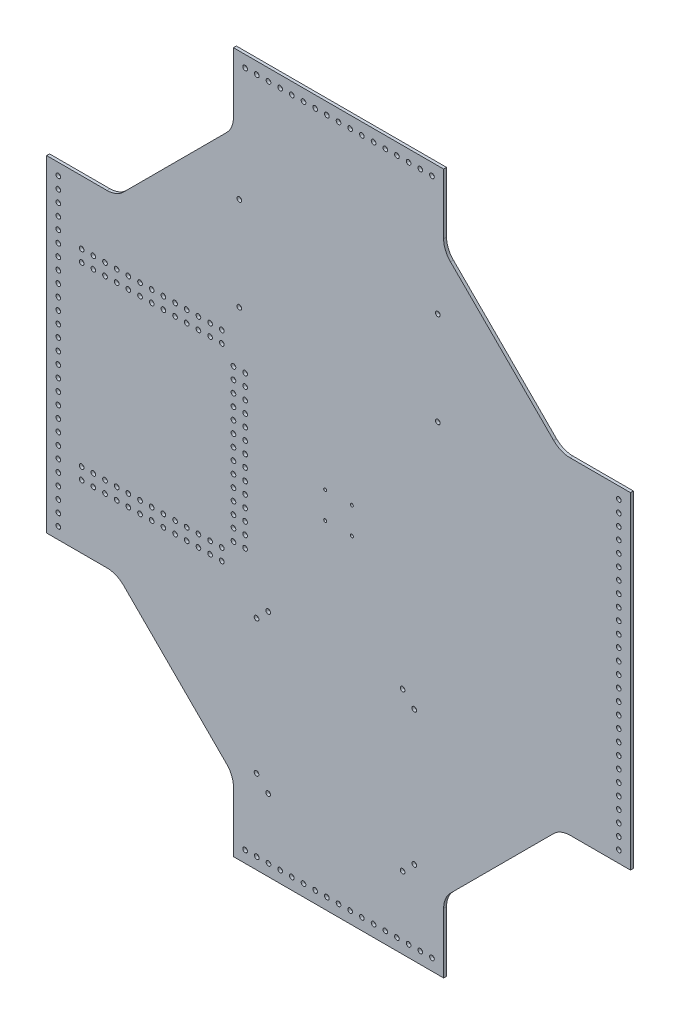
from build123d import *

# Parameters (mm, degrees)
BOSS_EXTRUDE1_DEPTH = 3.175
SKETCH2_R           = 2.54
CUT_EXTRUDE2_DEPTH  = 3.175
SKETCH3_R           = 1.651
SKETCH3_R_2         = 2.54
CUT_EXTRUDE3_DEPTH  = 3.175
SKETCH4_R           = 2.54
CUT_EXTRUDE5_DEPTH  = 3.175
SKETCH5_R           = 2.54
CUT_EXTRUDE7_DEPTH  = 3.175
FILLET1_R           = 25.4
FILLET2_R           = 25.4
FILLET3_R           = 25.4
FILLET4_R           = 25.4
FILLET5_R           = 25.4


with BuildPart() as part:
    # Sketch1 → Boss-Extrude1 (new body)
    with BuildSketch(Plane.XY):
        Polygon((-241.3, 177.8), (-317.5, 177.8), (-317.5, -177.8), (-241.3, -177.8), (-114.3, -304.8), (-114.3, -381), (114.3, -381), (114.3, -304.8), (241.3, -177.8), (317.5, -177.8), (317.5, 177.8), (241.3, 177.8), (114.3, 304.8), (114.3, 381), (-114.3, 381), (-114.3, 304.8), align=None)
    extrude(amount=BOSS_EXTRUDE1_DEPTH)

    # Sketch2 → Cut-Extrude2 (cut)
    with BuildSketch(Plane.XY.offset(3.175)):
        with Locations((-304.8, 165.1)):
            Circle(SKETCH2_R)
        with Locations((-304.8, 152.4)):
            Circle(SKETCH2_R)
        with Locations((-304.8, 139.7)):
            Circle(SKETCH2_R)
        with Locations((-304.8, 127)):
            Circle(SKETCH2_R)
        with Locations((-304.8, 114.3)):
            Circle(SKETCH2_R)
        with Locations((-304.8, 101.6)):
            Circle(SKETCH2_R)
        with Locations((-304.8, 88.9)):
            Circle(SKETCH2_R)
        with Locations((-304.8, 76.2)):
            Circle(SKETCH2_R)
        with Locations((-304.8, 63.5)):
            Circle(SKETCH2_R)
        with Locations((-304.8, 50.8)):
            Circle(SKETCH2_R)
        with Locations((-304.8, 38.1)):
            Circle(SKETCH2_R)
        with Locations((-304.8, 25.4)):
            Circle(SKETCH2_R)
        with Locations((-304.8, 12.7)):
            Circle(SKETCH2_R)
        with Locations((-304.8, 0)):
            Circle(SKETCH2_R)
        with Locations((-304.8, -12.7)):
            Circle(SKETCH2_R)
        with Locations((-304.8, -25.4)):
            Circle(SKETCH2_R)
        with Locations((-304.8, -38.1)):
            Circle(SKETCH2_R)
        with Locations((-304.8, -50.8)):
            Circle(SKETCH2_R)
        with Locations((-304.8, -63.5)):
            Circle(SKETCH2_R)
        with Locations((-304.8, -76.2)):
            Circle(SKETCH2_R)
        with Locations((-304.8, -88.9)):
            Circle(SKETCH2_R)
        with Locations((-304.8, -101.6)):
            Circle(SKETCH2_R)
        with Locations((-304.8, -114.3)):
            Circle(SKETCH2_R)
        with Locations((-304.8, -127)):
            Circle(SKETCH2_R)
        with Locations((-304.8, -139.7)):
            Circle(SKETCH2_R)
        with Locations((-304.8, -152.4)):
            Circle(SKETCH2_R)
        with Locations((-304.8, -165.1)):
            Circle(SKETCH2_R)
        with Locations((304.8, -165.1)):
            Circle(SKETCH2_R)
        with Locations((304.8, -152.4)):
            Circle(SKETCH2_R)
        with Locations((304.8, -139.7)):
            Circle(SKETCH2_R)
        with Locations((304.8, -127)):
            Circle(SKETCH2_R)
        with Locations((304.8, -114.3)):
            Circle(SKETCH2_R)
        with Locations((304.8, -101.6)):
            Circle(SKETCH2_R)
        with Locations((304.8, -88.9)):
            Circle(SKETCH2_R)
        with Locations((304.8, -76.2)):
            Circle(SKETCH2_R)
        with Locations((304.8, -63.5)):
            Circle(SKETCH2_R)
        with Locations((304.8, -50.8)):
            Circle(SKETCH2_R)
        with Locations((304.8, -38.1)):
            Circle(SKETCH2_R)
        with Locations((304.8, -25.4)):
            Circle(SKETCH2_R)
        with Locations((304.8, -12.7)):
            Circle(SKETCH2_R)
        with Locations((304.8, 0)):
            Circle(SKETCH2_R)
        with Locations((304.8, 12.7)):
            Circle(SKETCH2_R)
        with Locations((304.8, 25.4)):
            Circle(SKETCH2_R)
        with Locations((304.8, 38.1)):
            Circle(SKETCH2_R)
        with Locations((304.8, 50.8)):
            Circle(SKETCH2_R)
        with Locations((304.8, 63.5)):
            Circle(SKETCH2_R)
        with Locations((304.8, 76.2)):
            Circle(SKETCH2_R)
        with Locations((304.8, 88.9)):
            Circle(SKETCH2_R)
        with Locations((304.8, 101.6)):
            Circle(SKETCH2_R)
        with Locations((304.8, 114.3)):
            Circle(SKETCH2_R)
        with Locations((304.8, 127)):
            Circle(SKETCH2_R)
        with Locations((304.8, 139.7)):
            Circle(SKETCH2_R)
        with Locations((304.8, 152.4)):
            Circle(SKETCH2_R)
        with Locations((304.8, 165.1)):
            Circle(SKETCH2_R)
        with Locations((-101.6, -368.3)):
            Circle(SKETCH2_R)
        with Locations((-88.9, -368.3)):
            Circle(SKETCH2_R)
        with Locations((-76.2, -368.3)):
            Circle(SKETCH2_R)
        with Locations((-63.5, -368.3)):
            Circle(SKETCH2_R)
        with Locations((-50.8, -368.3)):
            Circle(SKETCH2_R)
        with Locations((-38.1, -368.3)):
            Circle(SKETCH2_R)
        with Locations((-25.4, -368.3)):
            Circle(SKETCH2_R)
        with Locations((-12.7, -368.3)):
            Circle(SKETCH2_R)
        with Locations((0, -368.3)):
            Circle(SKETCH2_R)
        with Locations((12.7, -368.3)):
            Circle(SKETCH2_R)
        with Locations((25.4, -368.3)):
            Circle(SKETCH2_R)
        with Locations((38.1, -368.3)):
            Circle(SKETCH2_R)
        with Locations((50.8, -368.3)):
            Circle(SKETCH2_R)
        with Locations((63.5, -368.3)):
            Circle(SKETCH2_R)
        with Locations((76.2, -368.3)):
            Circle(SKETCH2_R)
        with Locations((88.9, -368.3)):
            Circle(SKETCH2_R)
        with Locations((101.6, -368.3)):
            Circle(SKETCH2_R)
        with Locations((101.6, 368.3)):
            Circle(SKETCH2_R)
        with Locations((88.9, 368.3)):
            Circle(SKETCH2_R)
        with Locations((76.2, 368.3)):
            Circle(SKETCH2_R)
        with Locations((63.5, 368.3)):
            Circle(SKETCH2_R)
        with Locations((50.8, 368.3)):
            Circle(SKETCH2_R)
        with Locations((38.1, 368.3)):
            Circle(SKETCH2_R)
        with Locations((25.4, 368.3)):
            Circle(SKETCH2_R)
        with Locations((12.7, 368.3)):
            Circle(SKETCH2_R)
        with Locations((0, 368.3)):
            Circle(SKETCH2_R)
        with Locations((-12.7, 368.3)):
            Circle(SKETCH2_R)
        with Locations((-25.4, 368.3)):
            Circle(SKETCH2_R)
        with Locations((-38.1, 368.3)):
            Circle(SKETCH2_R)
        with Locations((-50.8, 368.3)):
            Circle(SKETCH2_R)
        with Locations((-63.5, 368.3)):
            Circle(SKETCH2_R)
        with Locations((-76.2, 368.3)):
            Circle(SKETCH2_R)
        with Locations((-88.9, 368.3)):
            Circle(SKETCH2_R)
        with Locations((-101.6, 368.3)):
            Circle(SKETCH2_R)
    extrude(amount=-CUT_EXTRUDE2_DEPTH, mode=Mode.SUBTRACT)

    # Sketch3 → Cut-Extrude3 (cut)
    with BuildSketch(Plane.XY.offset(3.175)):
        with Locations((-14.478, 14.478)):
            Circle(SKETCH3_R)
        with Locations((14.478, 14.478)):
            Circle(SKETCH3_R)
        with Locations((-14.478, -14.478)):
            Circle(SKETCH3_R)
        with Locations((14.478, -14.478)):
            Circle(SKETCH3_R)
        with Locations((-107.95, 241.3)):
            Circle(SKETCH3_R_2)
        with Locations((107.95, 241.3)):
            Circle(SKETCH3_R_2)
        with Locations((-107.95, 139.7)):
            Circle(SKETCH3_R_2)
        with Locations((107.95, 139.7)):
            Circle(SKETCH3_R_2)
    extrude(amount=-CUT_EXTRUDE3_DEPTH, mode=Mode.SUBTRACT)

    # Sketch4 → Cut-Extrude5 (cut)
    with BuildSketch(Plane.XY.offset(3.175)):
        with Locations((-114.3, -84.201)):
            Circle(SKETCH4_R)
        with Locations((-114.3, 80.899)):
            Circle(SKETCH4_R)
        with Locations((-279.4, 96.139)):
            Circle(SKETCH4_R)
        with Locations((-266.7, 96.139)):
            Circle(SKETCH4_R)
        with Locations((-254, 96.139)):
            Circle(SKETCH4_R)
        with Locations((-241.3, 96.139)):
            Circle(SKETCH4_R)
        with Locations((-228.6, 96.139)):
            Circle(SKETCH4_R)
        with Locations((-215.9, 96.139)):
            Circle(SKETCH4_R)
        with Locations((-203.2, 96.139)):
            Circle(SKETCH4_R)
        with Locations((-190.5, 96.139)):
            Circle(SKETCH4_R)
        with Locations((-177.8, 96.139)):
            Circle(SKETCH4_R)
        with Locations((-165.1, 96.139)):
            Circle(SKETCH4_R)
        with Locations((-152.4, 96.139)):
            Circle(SKETCH4_R)
        with Locations((-139.7, 96.139)):
            Circle(SKETCH4_R)
        with Locations((-127, 96.139)):
            Circle(SKETCH4_R)
        with Locations((-127, -96.139)):
            Circle(SKETCH4_R)
        with Locations((-139.7, -96.139)):
            Circle(SKETCH4_R)
        with Locations((-152.4, -96.139)):
            Circle(SKETCH4_R)
        with Locations((-165.1, -96.139)):
            Circle(SKETCH4_R)
        with Locations((-177.8, -96.139)):
            Circle(SKETCH4_R)
        with Locations((-190.5, -96.139)):
            Circle(SKETCH4_R)
        with Locations((-203.2, -96.139)):
            Circle(SKETCH4_R)
        with Locations((-215.9, -96.139)):
            Circle(SKETCH4_R)
        with Locations((-228.6, -96.139)):
            Circle(SKETCH4_R)
        with Locations((-241.3, -96.139)):
            Circle(SKETCH4_R)
        with Locations((-254, -96.139)):
            Circle(SKETCH4_R)
        with Locations((-266.7, -96.139)):
            Circle(SKETCH4_R)
        with Locations((-279.4, -96.139)):
            Circle(SKETCH4_R)
        with Locations((-279.4, -108.839)):
            Circle(SKETCH4_R)
        with Locations((-279.4, 108.839)):
            Circle(SKETCH4_R)
        with Locations((-266.7, 108.839)):
            Circle(SKETCH4_R)
        with Locations((-254, 108.839)):
            Circle(SKETCH4_R)
        with Locations((-241.3, 108.839)):
            Circle(SKETCH4_R)
        with Locations((-228.6, 108.839)):
            Circle(SKETCH4_R)
        with Locations((-215.9, 108.839)):
            Circle(SKETCH4_R)
        with Locations((-203.2, 108.839)):
            Circle(SKETCH4_R)
        with Locations((-190.5, 108.839)):
            Circle(SKETCH4_R)
        with Locations((-177.8, 108.839)):
            Circle(SKETCH4_R)
        with Locations((-165.1, 108.839)):
            Circle(SKETCH4_R)
        with Locations((-152.4, 108.839)):
            Circle(SKETCH4_R)
        with Locations((-139.7, 108.839)):
            Circle(SKETCH4_R)
        with Locations((-127, 108.839)):
            Circle(SKETCH4_R)
        with Locations((-127, -108.839)):
            Circle(SKETCH4_R)
        with Locations((-139.7, -108.839)):
            Circle(SKETCH4_R)
        with Locations((-152.4, -108.839)):
            Circle(SKETCH4_R)
        with Locations((-165.1, -108.839)):
            Circle(SKETCH4_R)
        with Locations((-177.8, -108.839)):
            Circle(SKETCH4_R)
        with Locations((-190.5, -108.839)):
            Circle(SKETCH4_R)
        with Locations((-203.2, -108.839)):
            Circle(SKETCH4_R)
        with Locations((-215.9, -108.839)):
            Circle(SKETCH4_R)
        with Locations((-228.6, -108.839)):
            Circle(SKETCH4_R)
        with Locations((-241.3, -108.839)):
            Circle(SKETCH4_R)
        with Locations((-254, -108.839)):
            Circle(SKETCH4_R)
        with Locations((-266.7, -108.839)):
            Circle(SKETCH4_R)
        with Locations((-114.3, 68.199)):
            Circle(SKETCH4_R)
        with Locations((-101.6, -84.201)):
            Circle(SKETCH4_R)
        with Locations((-101.6, -71.501)):
            Circle(SKETCH4_R)
        with Locations((-101.6, -58.801)):
            Circle(SKETCH4_R)
        with Locations((-101.6, -46.101)):
            Circle(SKETCH4_R)
        with Locations((-101.6, -33.401)):
            Circle(SKETCH4_R)
        with Locations((-101.6, -20.701)):
            Circle(SKETCH4_R)
        with Locations((-101.6, -8.001)):
            Circle(SKETCH4_R)
        with Locations((-101.6, 4.699)):
            Circle(SKETCH4_R)
        with Locations((-101.6, 17.399)):
            Circle(SKETCH4_R)
        with Locations((-101.6, 30.099)):
            Circle(SKETCH4_R)
        with Locations((-101.6, 42.799)):
            Circle(SKETCH4_R)
        with Locations((-101.6, 55.499)):
            Circle(SKETCH4_R)
        with Locations((-101.6, 68.199)):
            Circle(SKETCH4_R)
        with Locations((-101.6, 80.899)):
            Circle(SKETCH4_R)
        with Locations((-114.3, 55.499)):
            Circle(SKETCH4_R)
        with Locations((-114.3, 42.799)):
            Circle(SKETCH4_R)
        with Locations((-114.3, 30.099)):
            Circle(SKETCH4_R)
        with Locations((-114.3, 17.399)):
            Circle(SKETCH4_R)
        with Locations((-114.3, 4.699)):
            Circle(SKETCH4_R)
        with Locations((-114.3, -8.001)):
            Circle(SKETCH4_R)
        with Locations((-114.3, -20.701)):
            Circle(SKETCH4_R)
        with Locations((-114.3, -33.401)):
            Circle(SKETCH4_R)
        with Locations((-114.3, -46.101)):
            Circle(SKETCH4_R)
        with Locations((-114.3, -58.801)):
            Circle(SKETCH4_R)
        with Locations((-114.3, -71.501)):
            Circle(SKETCH4_R)
    extrude(amount=-CUT_EXTRUDE5_DEPTH, mode=Mode.SUBTRACT)

    # Sketch5 → Cut-Extrude7 (cut)
    with BuildSketch(Plane.XY.offset(3.175)):
        with Locations((-76.492754683, -131.119022234)):
            Circle(SKETCH5_R)
        with Locations((-89.192754683, -143.819022234)):
            Circle(SKETCH5_R)
        with Locations((69.658845317, -131.119022234)):
            Circle(SKETCH5_R)
        with Locations((82.358845317, -143.819022234)):
            Circle(SKETCH5_R)
        with Locations((82.358845317, -289.970622234)):
            Circle(SKETCH5_R)
        with Locations((69.658845317, -302.670622234)):
            Circle(SKETCH5_R)
        with Locations((-76.492754683, -302.670622234)):
            Circle(SKETCH5_R)
        with Locations((-89.192754683, -289.970622234)):
            Circle(SKETCH5_R)
    extrude(amount=-CUT_EXTRUDE7_DEPTH, mode=Mode.SUBTRACT)

    # Fillet1
    fillet1_edges = [part.edges().sort_by_distance(p)[0] for p in [
        (-241.3, -177.8, 1.5875),
    ]]
    fillet(fillet1_edges, radius=FILLET1_R)

    # Fillet2
    fillet2_edges = [part.edges().sort_by_distance(p)[0] for p in [
        (-114.3, -304.8, 1.5875),
    ]]
    fillet(fillet2_edges, radius=FILLET2_R)

    # Fillet3
    fillet3_edges = [part.edges().sort_by_distance(p)[0] for p in [
        (114.3, -304.8, 1.5875),
        (241.3, -177.8, 1.5875),
    ]]
    fillet(fillet3_edges, radius=FILLET3_R)

    # Fillet4
    fillet4_edges = [part.edges().sort_by_distance(p)[0] for p in [
        (114.3, 304.8, 1.5875),
        (241.3, 177.8, 1.5875),
    ]]
    fillet(fillet4_edges, radius=FILLET4_R)

    # Fillet5
    fillet5_edges = [part.edges().sort_by_distance(p)[0] for p in [
        (-241.3, 177.8, 1.5875),
        (-114.3, 304.8, 1.5875),
    ]]
    fillet(fillet5_edges, radius=FILLET5_R)


solid = part.part
